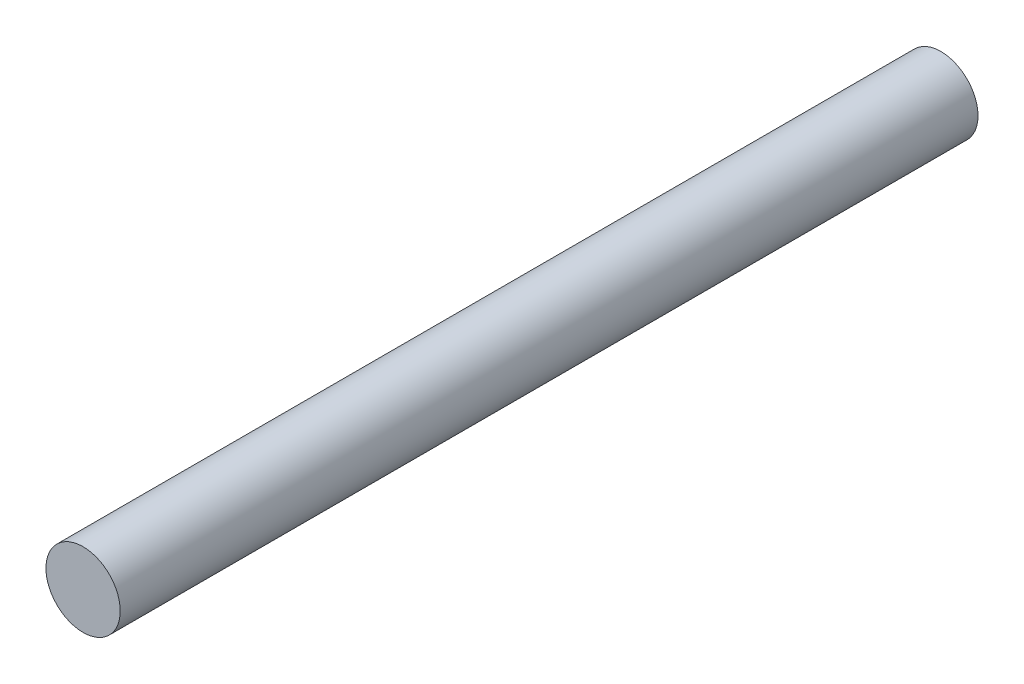
from build123d import *

# Parameters (mm, degrees)
SKETCH1_R           = 5.5
BOSS_EXTRUDE1_DEPTH = 63.5


with BuildPart() as part:
    # Sketch1 → Boss-Extrude1 (new, symmetric)
    with BuildSketch(Plane.XY):
        Circle(SKETCH1_R)
    extrude(amount=BOSS_EXTRUDE1_DEPTH, both=True)


solid = part.part
